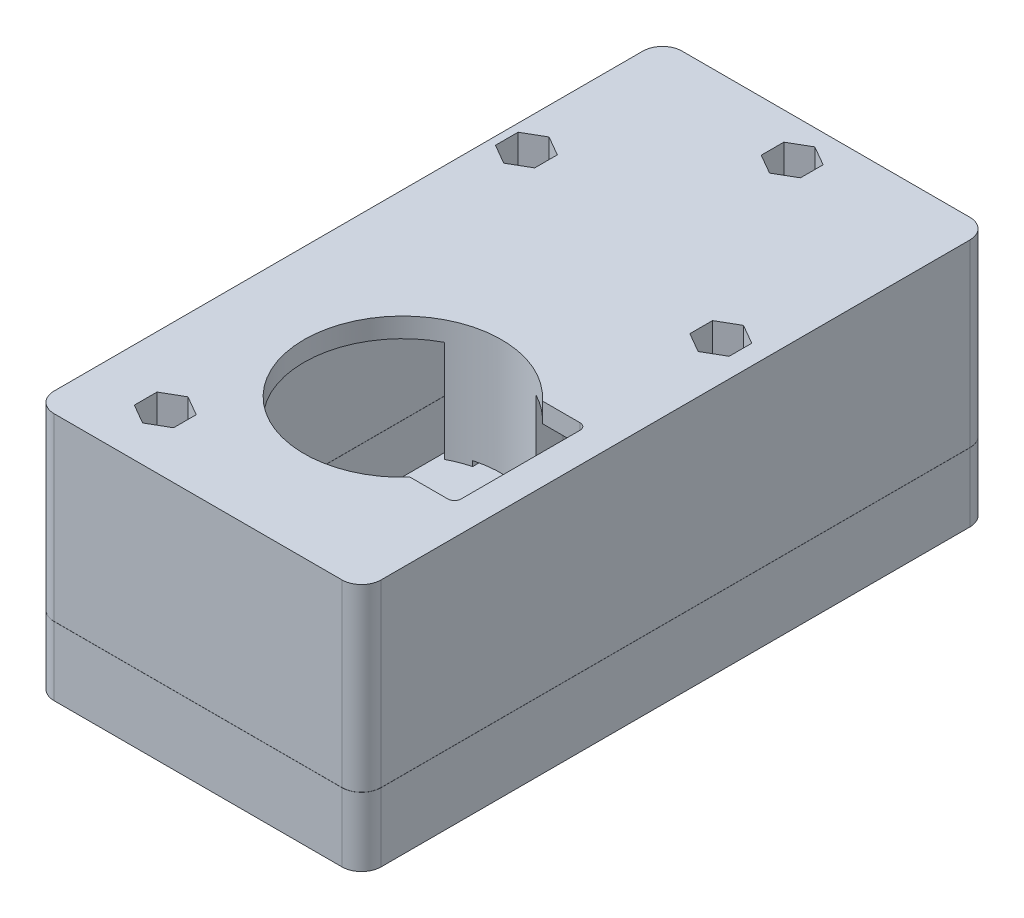
from build123d import *
from build123d.topology import SkipClean

# Parameters (mm, degrees)
SKETCH_1_W               = 50
SKETCH_1_H               = 38
EXTRUDE_1_DEPTH          = 3
SKETCH_2_W               = 50
SKETCH_2_H               = 38
SKETCH_2_W_2             = 44
SKETCH_2_H_2             = 32
EXTRUDE_2_DEPTH          = 90
SKETCH_4_R               = 7.3
CUT_EXTRUDE_1_DEPTH      = 45.2
SKETCH_5_R               = 10.3
SKETCH_5_R_2             = 7.3
EXTRUDE_3_DEPTH          = 16
SKETCH_6_R               = 8.3
SKETCH_6_R_2             = 5.8
EXTRUDE_5_DEPTH          = 1
SKETCH_7_R               = 4.3
EXTRUDE_6_DEPTH          = 2
SKETCH_8_R               = 6.3
SKETCH_8_R_2             = 4.3
EXTRUDE_7_DEPTH          = 10
SKETCH_9_W               = 2.635644668
SKETCH_9_H               = 4.5
CUT_EXTRUDE_2_DEPTH      = 4
SKETCH_10_R              = 0.7
SKETCH_10_W              = 2.7
SKETCH_10_H              = 2
EXTRUDE_8_DEPTH          = 32
SKETCH_11_W              = 14.06
SKETCH_11_H              = 9.36
EXTRUDE_9_DEPTH          = 4.4
SKETCH_12_W              = 14.06
SKETCH_12_H              = 9.36
EXTRUDE_10_DEPTH         = 21.2
CUT_EXTRUDE_3_DEPTH      = 3
SKETCH_14_R              = 1.65
EXTRUDE_11_DEPTH         = 15.5
EXTRUDE_12_DEPTH         = 15.5
CUT_EXTRUDE_4_DEPTH      = 0.8
EXTRUDE_13_DEPTH         = 18
SKETCH_18_W              = 19.83
SKETCH_18_H              = 32
SKETCH_18_R              = 6.3
EXTRUDE_14_DEPTH         = 10
SKETCH_19_W              = 4.445486426
SKETCH_19_H              = 4.5
CUT_EXTRUDE_5_DEPTH      = 4
EXTRUDE_16_REACH         = 110.743
SKETCH_23_R              = 1.65
CUT_EXTRUDE_7_DEPTH      = 109.742815855
CUT_EXTRUDE_7_DEPTH_BACK = 109.742815855
SKETCH_25_R              = 1.65
CUT_EXTRUDE_8_DEPTH      = 24.5
SKETCH_29_W              = 50
SKETCH_29_H              = 38
EXTRUDE_17_DEPTH         = 3
FILLET_1_R               = 3
SKETCH_30_W              = 96
SKETCH_30_H              = 0.02
CUT_EXTRUDE_9_DEPTH      = 113.218536793


with BuildPart() as part:
    # 草图1 → 凸台-拉伸1 (new body)
    with BuildSketch(Plane.XY):
        with Locations((25, 19)):
            Rectangle(SKETCH_1_W, SKETCH_1_H)
    extrude(amount=-EXTRUDE_1_DEPTH)

    # 草图2 → 凸台-拉伸2 (add)
    with BuildSketch(Plane.XY):
        with Locations((25, 19)):
            Rectangle(SKETCH_2_W, SKETCH_2_H)
        with Locations((25, 19)):
            Rectangle(SKETCH_2_W_2, SKETCH_2_H_2, mode=Mode.SUBTRACT)
    extrude(amount=EXTRUDE_2_DEPTH)

    # 草图4 → 切除-拉伸1 (cut)
    with BuildSketch(Plane(origin=(0, 0, -3), x_dir=(-1, 0, 0), z_dir=(0, 0, -1))):
        with Locations((-12.5, 10.5)):
            Circle(SKETCH_4_R)
    extrude(amount=-CUT_EXTRUDE_1_DEPTH, mode=Mode.SUBTRACT)

    # 草图5 → 凸台-拉伸3 (add)
    with BuildSketch(Plane.XY):
        with Locations((12.5, 10.5)):
            Circle(SKETCH_5_R)
        with Locations(Location((12.5, 10.5, 0), (0, 0, 180))):
            Circle(SKETCH_5_R_2, mode=Mode.SUBTRACT)
    extrude(amount=EXTRUDE_3_DEPTH)

    # 草图6 → 凸台-拉伸5 (add)
    with BuildSketch(Plane(origin=(0, 0, -3), x_dir=(-1, 0, 0), z_dir=(0, 0, -1))):
        with Locations((-12.5, 10.5)):
            Circle(SKETCH_6_R)
        with Locations((-12.5, 10.5)):
            Circle(SKETCH_6_R_2, mode=Mode.SUBTRACT)
    extrude(amount=-EXTRUDE_5_DEPTH)

    # 草图7 → 凸台-拉伸6 (add)
    with BuildSketch(Plane.XY.offset(16)):
        with BuildLine():
            Line((5.440254962, 3), (19.559745038, 3))
            ThreePointArc((19.559745038, 3), (18.368221419, 18.964867239), (3, 14.479949748))
            Line((3, 14.479949748), (3, 6.520050252))
            ThreePointArc((3, 6.520050252), (4.035132761, 4.631778581), (5.440254962, 3))
        make_face()
        with Locations((12.5, 10.5)):
            Circle(SKETCH_7_R, mode=Mode.SUBTRACT)
    extrude(amount=EXTRUDE_6_DEPTH)

    # 草图8 → 凸台-拉伸7 (add)
    with BuildSketch(Plane.XY.offset(18)):
        with Locations((12.5, 10.5)):
            Circle(SKETCH_8_R)
        with Locations((12.5, 10.5)):
            Circle(SKETCH_8_R_2, mode=Mode.SUBTRACT)
    extrude(amount=EXTRUDE_7_DEPTH)

    # 草图9 → 切除-拉伸2 (cut)
    with BuildSketch(Plane.XY.offset(28)):
        with Locations((17.482177666, 10.5)):
            Rectangle(SKETCH_9_W, SKETCH_9_H)
    extrude(amount=-CUT_EXTRUDE_2_DEPTH, mode=Mode.SUBTRACT)

    # 草图10 → 凸台-拉伸8 (add)
    with BuildSketch(Plane(origin=(0, 3, 0), x_dir=(1, 0, 0), z_dir=(0, 1, 0))):
        with Locations(Location((19.92, -32.88, 0), (0, 0, 180))):
            Circle(SKETCH_10_R)
        with Locations(Location((26.54, -32.88, 0), (0, 0, 180))):
            Circle(SKETCH_10_R)
        with Locations((20.68, -35.76)):
            Rectangle(SKETCH_10_W, SKETCH_10_H)
        with Locations((25.78, -35.76)):
            Rectangle(SKETCH_10_W, SKETCH_10_H)
    extrude(amount=EXTRUDE_8_DEPTH)

    # 草图11 → 凸台-拉伸9 (add)
    with BuildSketch(Plane(origin=(0, 3, 0), x_dir=(1, 0, 0), z_dir=(0, 1, 0))):
        with Locations((23.23, -32.08)):
            Rectangle(SKETCH_11_W, SKETCH_11_H)
    extrude(amount=EXTRUDE_9_DEPTH)

    # 草图12 → 凸台-拉伸10 (add)
    with BuildSketch(Plane.XZ.offset(-35)):
        with Locations((23.23, 32.08)):
            Rectangle(SKETCH_12_W, SKETCH_12_H)
    extrude(amount=EXTRUDE_10_DEPTH)

    # 草图13 → 切除-拉伸3 (cut)
    with BuildSketch(Plane(origin=(0, 38, 0), x_dir=(1, 0, 0), z_dir=(0, 1, 0))):
        with BuildLine():
            Line((38.62497216, -74.195968058), (44.4, -74.195968058))
            ThreePointArc((44.4, -74.195968058), (45.107106781, -73.903074839), (45.4, -73.195968058))
            Line((45.4, -73.195968058), (45.4, -54.995968058))
            ThreePointArc((45.4, -54.995968058), (45.107106781, -54.288861277), (44.4, -53.995968058))
            Line((44.4, -53.995968058), (38.62497216, -53.995968058))
            ThreePointArc((38.62497216, -53.995968058), (12.3, -64.095968058), (38.62497216, -74.195968058))
        make_face()
    extrude(amount=-CUT_EXTRUDE_3_DEPTH, mode=Mode.SUBTRACT)

    # 草图14 → 凸台-拉伸11 (add)
    # profile 1 of 2: a face of its own
    with SkipClean():  # the faces are left unmerged after this step: merging them gives an invalid solid
        with BuildSketch(Plane.XZ.offset(-35)):
            with BuildLine():
                Line((23.9, 46.595968058), (23.9, 49.407196837))
                ThreePointArc((23.9, 49.407196837), (27.4, 48.995968058), (30.9, 49.407196837))
                Line((30.9, 49.407196837), (30.9, 46.595968058))
                ThreePointArc((30.9, 46.595968058), (27.4, 43.095968058), (23.9, 46.595968058))
            make_face()
            with Locations((27.4, 46.595968058)):
                Circle(SKETCH_14_R, mode=Mode.SUBTRACT)
        # profile 2 of 2: a face of its own
        with BuildSketch(Plane.XZ.offset(-35)):
            with BuildLine():
                Line((30.9, 81.595968058), (30.9, 78.78473928))
                ThreePointArc((30.9, 78.78473928), (27.4, 79.195968058), (23.9, 78.78473928))
                Line((23.9, 78.78473928), (23.9, 81.595968058))
                ThreePointArc((23.9, 81.595968058), (27.4, 85.095968058), (30.9, 81.595968058))
            make_face()
            with Locations(Location((27.4, 81.595968058, 0), (0, 0, 90))):
                Circle(SKETCH_14_R, mode=Mode.SUBTRACT)
        extrude(amount=EXTRUDE_11_DEPTH)

    # 草图15 → 凸台-拉伸12 (add)
    with SkipClean():  # the faces are left unmerged after this step: merging them gives an invalid solid
        with BuildSketch(Plane.XZ.offset(-35)):
            with BuildLine():
                ThreePointArc((23.9, 49.407196837), (22.109340992, 49.953163271), (20.4, 50.716506186))
                Line((20.4, 50.716506186), (20.4, 46.595968058))
                ThreePointArc((20.4, 46.595968058), (27.4, 39.595968058), (34.4, 46.595968058))
                Line((34.4, 46.595968058), (34.4, 50.716506186))
                ThreePointArc((34.4, 50.716506186), (32.690659008, 49.953163271), (30.9, 49.407196837))
                Line((30.9, 49.407196837), (30.9, 46.595968058))
                ThreePointArc((30.9, 46.595968058), (27.4, 43.095968058), (23.9, 46.595968058))
                Line((23.9, 46.595968058), (23.9, 49.407196837))
            make_face()
            with BuildLine():
                Line((20.4, 81.595968058), (20.4, 77.475429931))
                ThreePointArc((20.4, 77.475429931), (22.109340992, 78.238772846), (23.9, 78.78473928))
                Line((23.9, 78.78473928), (23.9, 81.595968058))
                ThreePointArc((23.9, 81.595968058), (27.4, 85.095968058), (30.9, 81.595968058))
                Line((30.9, 81.595968058), (30.9, 78.78473928))
                ThreePointArc((30.9, 78.78473928), (32.690659008, 78.238772846), (34.4, 77.475429931))
                Line((34.4, 77.475429931), (34.4, 81.595968058))
                ThreePointArc((34.4, 81.595968058), (27.4, 88.595968058), (20.4, 81.595968058))
            make_face()
        extrude(amount=EXTRUDE_12_DEPTH)

    # 草图16 → 切除-拉伸4 (cut)
    with SkipClean():  # the faces are left unmerged after this step: merging them gives an invalid solid
        with BuildSketch(Plane.XZ.offset(-19.5)):
            with BuildLine():
                Line((31.3, 81.595968058), (31.3, 77.229132186))
                ThreePointArc((31.3, 77.229132186), (27.4, 77.795968058), (23.5, 77.229132186))
                Line((23.5, 77.229132186), (23.5, 81.595968058))
                ThreePointArc((23.5, 81.595968058), (27.4, 85.495968058), (31.3, 81.595968058))
            make_face()
            with BuildLine():
                Line((31.3, 46.595968058), (31.3, 50.962803931))
                ThreePointArc((31.3, 50.962803931), (27.4, 50.395968058), (23.5, 50.962803931))
                Line((23.5, 50.962803931), (23.5, 46.595968058))
                ThreePointArc((23.5, 46.595968058), (27.4, 42.695968058), (31.3, 46.595968058))
            make_face()
        extrude(amount=-CUT_EXTRUDE_4_DEPTH, mode=Mode.SUBTRACT)

    # 草图17 → 凸台-拉伸13 (add)
    with SkipClean():  # the faces are left unmerged after this step: merging them gives an invalid solid
        with BuildSketch(Plane.XY):
            with BuildLine():
                Line((22.83, 3), (22.83, 10.539153682))
                Line((22.83, 10.539153682), (22.83, 35))
                Line((22.83, 35), (3, 35))
                Line((3, 35), (3, 14.479949748))
                ThreePointArc((3, 14.479949748), (18.368221419, 18.964867239), (19.559745038, 3))
                Line((19.559745038, 3), (22.83, 3))
            make_face()
            with BuildLine():
                Line((5.440254962, 3), (3, 3))
                Line((3, 3), (3, 6.520050252))
                ThreePointArc((3, 6.520050252), (4.035132761, 4.631778581), (5.440254962, 3))
            make_face()
        extrude(amount=EXTRUDE_13_DEPTH)

    # 草图18 → 凸台-拉伸14 (add)
    with SkipClean():  # the faces are left unmerged after this step: merging them gives an invalid solid
        with BuildSketch(Plane.XY.offset(18)):
            with Locations((12.915, 19)):
                Rectangle(SKETCH_18_W, SKETCH_18_H)
            with Locations((12.5, 10.5)):
                Circle(SKETCH_18_R, mode=Mode.SUBTRACT)
        extrude(amount=EXTRUDE_14_DEPTH)

    # 草图19 → 切除-拉伸5 (cut)
    with SkipClean():  # the faces are left unmerged after this step: merging them gives an invalid solid
        with BuildSketch(Plane.XY.offset(28)):
            with Locations((20.607256787, 10.5)):
                Rectangle(SKETCH_19_W, SKETCH_19_H)
        extrude(amount=-CUT_EXTRUDE_5_DEPTH, mode=Mode.SUBTRACT)

    # 草图23 → 凸台-拉伸16 (add, up to next)
    with BuildSketch(Plane.XZ.offset(-35), mode=Mode.PRIVATE) as extrude_16_sk1:
        with BuildLine():
            Line((22.83, 0), (22.83, 9))
            ThreePointArc((22.83, 9), (29.193961031, 6.363961031), (31.83, 0))
            Line((31.83, 0), (22.83, 0))
        make_face()
        with Locations(Location((25.83, 3, 0), (0, 0, 180))):
            Circle(SKETCH_23_R, mode=Mode.SUBTRACT)
    extrude_16_tool1 = extrude(extrude_16_sk1.sketch, amount=EXTRUDE_16_REACH, mode=Mode.PRIVATE) - part.part
    # 草图23 → 凸台-拉伸16 (add, up to next)
    with BuildSketch(Plane.XZ.offset(-35), mode=Mode.PRIVATE) as extrude_16_sk2:
        with BuildLine():
            Line((44, 26.08), (47, 26.08))
            Line((47, 26.08), (47, 38.08))
            Line((47, 38.08), (44, 38.08))
            ThreePointArc((44, 38.08), (38, 32.08), (44, 26.08))
        make_face()
        with Locations(Location((44, 32.08, 0), (0, 0, 180))):
            Circle(SKETCH_23_R, mode=Mode.SUBTRACT)
    extrude_16_tool2 = extrude(extrude_16_sk2.sketch, amount=EXTRUDE_16_REACH, mode=Mode.PRIVATE) - part.part
    # 草图23 → 凸台-拉伸16 (add, up to next)
    with BuildSketch(Plane.XZ.offset(-35), mode=Mode.PRIVATE) as extrude_16_sk3:
        with BuildLine():
            Line((5, 90), (5, 84))
            ThreePointArc((5, 84), (11, 78), (17, 84))
            Line((17, 84), (17, 90))
            Line((17, 90), (5, 90))
        make_face()
        with Locations(Location((11, 84, 0), (0, 0, 180))):
            Circle(SKETCH_23_R, mode=Mode.SUBTRACT)
    extrude_16_tool3 = extrude(extrude_16_sk3.sketch, amount=EXTRUDE_16_REACH, mode=Mode.PRIVATE) - part.part
    add(extrude_16_tool1.solids().sort_by_distance((27.33, 35, 0.127279))[0])
    add(extrude_16_tool2.solids().sort_by_distance((45.5, 35, 26.23))[0])
    add(extrude_16_tool3.solids().sort_by_distance((11, 35, 78.169706))[0])

    # 草图25 → 切除-拉伸7 (cut, two sides: drawn at the far end of the back side and taken through both)
    with BuildSketch(Plane.XZ.offset(-35).offset(-CUT_EXTRUDE_7_DEPTH_BACK)):
        with Locations((4.2, 22)):
            Circle(SKETCH_25_R)
        with Locations((25.83, 3)):
            Circle(SKETCH_25_R)
        with Locations((44, 32.08)):
            Circle(SKETCH_25_R)
        with Locations((11, 84)):
            Circle(SKETCH_25_R)
    extrude(amount=CUT_EXTRUDE_7_DEPTH + CUT_EXTRUDE_7_DEPTH_BACK, mode=Mode.SUBTRACT)

    # 草图26 → 切除-拉伸8 (cut)
    with SkipClean():  # the faces are left unmerged after this step: merging them gives an invalid solid
        with BuildSketch(Plane(origin=(0, 38, 0), x_dir=(1, 0, 0), z_dir=(0, 1, 0))):
            Polygon((4.2, -18.537081721), (1.201024799, -20.268540861), (1.201024799, -23.731459139), (4.2, -25.462918279), (7.198975201, -23.731459139), (7.198975201, -20.268540861), align=None)
            Polygon((25.83, -6.462918279), (28.828975201, -4.731459139), (28.828975201, -1.268540861), (25.83, 0.462918279), (22.831024799, -1.268540861), (22.831024799, -4.731459139), align=None)
            Polygon((11, -80.537081721), (8.001024799, -82.268540861), (8.001024799, -85.731459139), (11, -87.462918279), (13.998975201, -85.731459139), (13.998975201, -82.268540861), align=None)
            Polygon((44, -28.617081721), (41.001024799, -30.348540861), (41.001024799, -33.811459139), (44, -35.542918279), (46.998975201, -33.811459139), (46.998975201, -30.348540861), align=None)
        extrude(amount=-CUT_EXTRUDE_8_DEPTH, mode=Mode.SUBTRACT)

    # 草图29 → 凸台-拉伸17 (add)
    with SkipClean():  # the faces are left unmerged after this step: merging them gives an invalid solid
        with BuildSketch(Plane.XY.offset(90)):
            with Locations((25, 19)):
                Rectangle(SKETCH_29_W, SKETCH_29_H)
        extrude(amount=EXTRUDE_17_DEPTH)

    # 圆角1
    fillet_1_edges = [part.edges().sort_by_distance(p)[0] for p in [
        (0, 19, -3),
        (50, 19, -3),
        (0, 19, 93),
        (50, 19, 93),
    ]]
    fillet(fillet_1_edges, radius=FILLET_1_R - 0.0001)  # a hair under: the kernel refuses the full size

    # 草图30 → 切除-拉伸9 (cut, through all)
    with BuildSketch(Plane(origin=(50, 0, 0), x_dir=(0, 0, -1), z_dir=(1, 0, 0))):
        with Locations((-45, 10.5)):
            Rectangle(SKETCH_30_W, SKETCH_30_H)
    extrude(amount=-CUT_EXTRUDE_9_DEPTH, mode=Mode.SUBTRACT)


with BuildPart() as cut_extrude_9_piece_1:
    # of the separate pieces the step leaves, piece 1, a body of its own (cut_extrude_9_pieces)
    add(part.part.solids().sort_by_distance((47.0001, 38, -3))[0])


with BuildPart() as cut_extrude_9_piece_2:
    # of the separate pieces the step leaves, piece 2, a body of its own (cut_extrude_9_pieces)
    add(part.part.solids().sort_by_distance((47.0001, 0, -3))[0])


solid = Compound([cut_extrude_9_piece_1.part, cut_extrude_9_piece_2.part])
